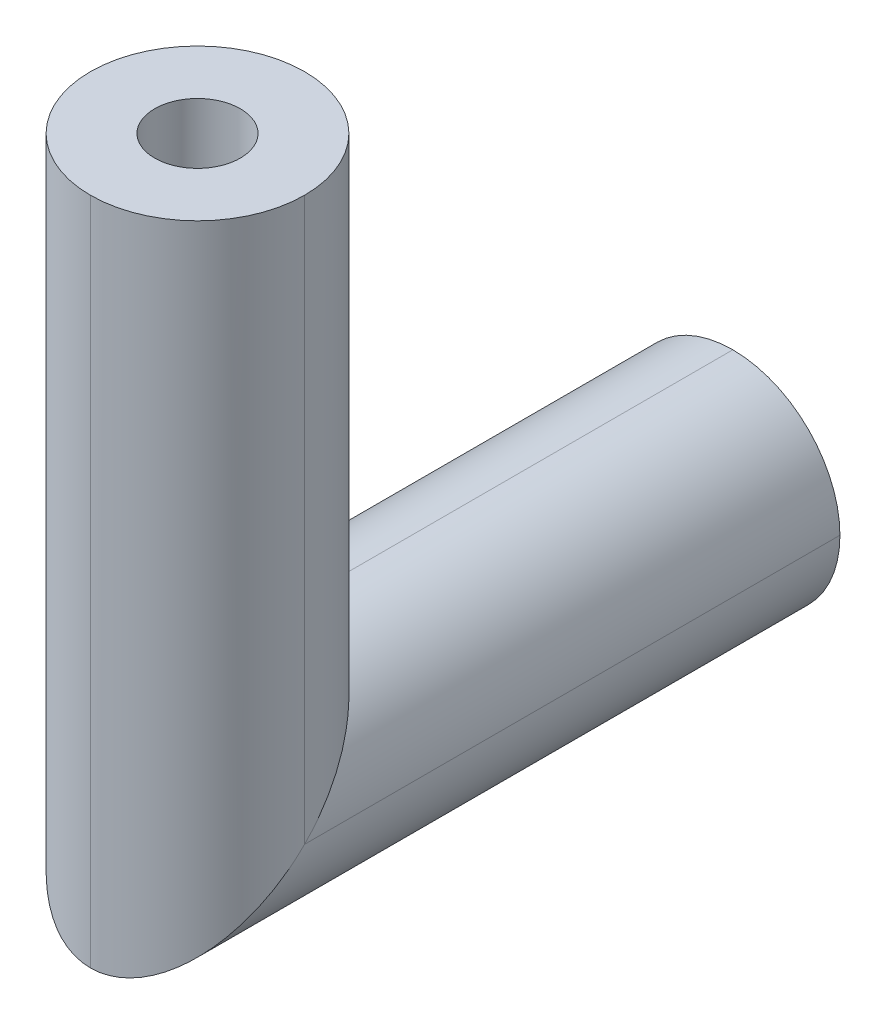
from build123d import *

# Parameters (mm, degrees)
ESQUISSE4_W             = 8
ESQUISSE4_H             = 4
BOSS_EXTRU_2_DEPTH      = 4
ESQUISSE10_R            = 0.8
ENL_V_MAT_EXTRU_3_DEPTH = 8
ENL_V_START             = -4
ESQUISSE11_R            = 0.8
ENL_V_MAT_EXTRU_4_DEPTH = 4
ESQUISSE7_R             = 0.8
ENL_V_MAT_EXTRU_2_DEPTH = 8
CONG_4_R                = 2


with BuildPart() as part:
    # Esquisse4 → Boss.-Extru.2 (new body)
    with BuildSketch(Plane(origin=(0, 0, 0), x_dir=(0, 0, -1), z_dir=(1, 0, 0))):
        with Locations((8, 2)):
            Rectangle(ESQUISSE4_W, ESQUISSE4_H)
        Polygon((4, 0), (4, 4), (4, 12.5), (0, 12.5), (0, 0), align=None)
    extrude(amount=BOSS_EXTRU_2_DEPTH)

    # Esquisse10 → Enlèv. mat.-Extru.3 (cut)
    with BuildSketch(Plane(origin=(0, 12.5, 0), x_dir=(1, 0, 0), z_dir=(0, 1, 0))):
        with Locations(Location((2, 2, 0), (0, 0, 270))):
            Circle(ESQUISSE10_R)
    extrude(amount=-ENL_V_MAT_EXTRU_3_DEPTH, mode=Mode.SUBTRACT)

    # Esquisse11 → Enlèv. mat.-Extru.4 (cut)
    with BuildSketch(Plane.XZ.offset(ENL_V_START)):
        with Locations(Location((2, -2, 0), (0, 0, 90))):
            Circle(ESQUISSE11_R)
    extrude(amount=ENL_V_MAT_EXTRU_4_DEPTH, mode=Mode.SUBTRACT)

    # Esquisse7 → Enlèv. mat.-Extru.2 (cut)
    with BuildSketch(Plane(origin=(0, 0, -12), x_dir=(1, 0, 0), z_dir=(0, 0, -1))):
        with Locations(Location((2, -2, 0), (0, 0, 270))):
            Circle(ESQUISSE7_R)
    extrude(amount=-ENL_V_MAT_EXTRU_2_DEPTH, mode=Mode.SUBTRACT)

    # Congé4
    # the kernel refuses this fillet: 2 mm, written as the material it takes off along each edge
    with BuildSketch(Plane(origin=(4, 0, -17), x_dir=(-1, 0, 0), z_dir=(0, 0, 1)), Plane(origin=(0, 0, 5), x_dir=(1, 0, 0), z_dir=(0, 0, -1))) as cong_4_piece_1:
        with BuildLine():
            CenterArc((CONG_4_R, -CONG_4_R), CONG_4_R, 90, 90)
            Line((0, -CONG_4_R), (0, 0))
            Line((0, 0), (CONG_4_R, 0))
        make_face()
    extrude(amount=22, mode=Mode.SUBTRACT)
    with BuildSketch(Plane(origin=(4, 17.5, -4), x_dir=(0, 0, 1), z_dir=(0, -1, 0)), Plane(origin=(0, 4, -4), x_dir=(0, 0, 1), z_dir=(0, 1, 0))) as cong_4_piece_2:
        with BuildLine():
            CenterArc((CONG_4_R, CONG_4_R), CONG_4_R, 180, 90)
            Line((0, CONG_4_R), (0, 0))
            Line((0, 0), (CONG_4_R, 0))
        make_face()
    extrude(amount=13.5, mode=Mode.SUBTRACT)
    with BuildSketch(Plane(origin=(4, 4, -17), x_dir=(0, -1, 0), z_dir=(0, 0, 1))) as cong_4_piece_3:
        with BuildLine():
            CenterArc((CONG_4_R, -CONG_4_R), CONG_4_R, 90, 90)
            Line((0, -CONG_4_R), (0, 0))
            Line((0, 0), (CONG_4_R, 0))
        make_face()
    extrude(amount=13, mode=Mode.SUBTRACT)
    with BuildSketch(Plane(origin=(0, 4, -17), x_dir=(0, -1, 0), z_dir=(0, 0, 1))) as cong_4_piece_4:
        with BuildLine():
            CenterArc((CONG_4_R, CONG_4_R), CONG_4_R, 180, 90)
            Line((0, CONG_4_R), (0, 0))
            Line((0, 0), (CONG_4_R, 0))
        make_face()
    extrude(amount=13, mode=Mode.SUBTRACT)
    with BuildSketch(Plane(origin=(4, 17.5, 0), x_dir=(0, 0, -1), z_dir=(0, -1, 0))) as cong_4_piece_5:
        with BuildLine():
            CenterArc((CONG_4_R, -CONG_4_R), CONG_4_R, 90, 90)
            Line((0, -CONG_4_R), (0, 0))
            Line((0, 0), (CONG_4_R, 0))
        make_face()
    extrude(amount=22.5, mode=Mode.SUBTRACT)
    with BuildSketch(Plane(origin=(0, 17.5, 0), x_dir=(0, 0, -1), z_dir=(0, -1, 0))) as cong_4_piece_6:
        with BuildLine():
            CenterArc((CONG_4_R, CONG_4_R), CONG_4_R, 180, 90)
            Line((0, CONG_4_R), (0, 0))
            Line((0, 0), (CONG_4_R, 0))
        make_face()
    extrude(amount=22.5, mode=Mode.SUBTRACT)
    with BuildSketch(Plane(origin=(4, 4, -12), x_dir=(0, -1, 0), z_dir=(0, 0, 1))) as cong_4_piece_7a_section:
        with BuildLine():
            CenterArc((CONG_4_R, -CONG_4_R), CONG_4_R, 90, 90)
            Line((0, -CONG_4_R), (0, 0))
            Line((0, 0), (CONG_4_R, 0))
        make_face()
    cong_4_piece_7a = extrude(amount=13, mode=Mode.PRIVATE)
    cong_4_piece_7a = split(cong_4_piece_7a, bisect_by=Plane(origin=(4, 4, 0), z_dir=(0, 0, -1)), keep=Keep.TOP, mode=Mode.PRIVATE)
    cong_4_piece_7a = cong_4_piece_7a - Plane(origin=(2, 4, -2), x_dir=(0, 0, 1), z_dir=(0, 1, 0)) * Cylinder(0.8, 35, mode=Mode.PRIVATE)
    cong_4_piece_7a = split(cong_4_piece_7a, bisect_by=Plane(origin=(4, 4, -4), z_dir=(0, 0, 1)), keep=Keep.TOP, mode=Mode.PRIVATE)
    with BuildSketch(Plane(origin=(4, 12.5, -4), x_dir=(0, 0, 1), z_dir=(0, -1, 0))) as cong_4_piece_7b_section:
        with BuildLine():
            CenterArc((CONG_4_R, CONG_4_R), CONG_4_R, 180, 90)
            Line((0, CONG_4_R), (0, 0))
            Line((0, 0), (CONG_4_R, 0))
        make_face()
    cong_4_piece_7b = extrude(amount=13.5, mode=Mode.PRIVATE)
    cong_4_piece_7b = split(cong_4_piece_7b, bisect_by=Plane(origin=(4, 0, -4), z_dir=(0, 1, 0)), keep=Keep.TOP, mode=Mode.PRIVATE)
    cong_4_piece_7b = split(cong_4_piece_7b, bisect_by=Plane(origin=(4, 4, -4), z_dir=(0, -1, 0)), keep=Keep.TOP, mode=Mode.PRIVATE)
    cong_4_piece_7b = cong_4_piece_7b - Plane(origin=(2, 2, -4), x_dir=(0, 1, 0), z_dir=(0, 0, -1)) * Cylinder(0.8, 35, mode=Mode.PRIVATE)
    cong_4_piece_7 = cong_4_piece_7a & cong_4_piece_7b
    add(cong_4_piece_7, mode=Mode.SUBTRACT)
    with BuildSketch(Plane(origin=(0, 4, -12), x_dir=(0, -1, 0), z_dir=(0, 0, 1))) as cong_4_piece_8a_section:
        with BuildLine():
            CenterArc((CONG_4_R, CONG_4_R), CONG_4_R, 180, 90)
            Line((0, CONG_4_R), (0, 0))
            Line((0, 0), (CONG_4_R, 0))
        make_face()
    cong_4_piece_8a = extrude(amount=13, mode=Mode.PRIVATE)
    cong_4_piece_8a = split(cong_4_piece_8a, bisect_by=Plane(origin=(0, 4, 0), z_dir=(0, 0, -1)), keep=Keep.TOP, mode=Mode.PRIVATE)
    cong_4_piece_8a = cong_4_piece_8a - Plane(origin=(2, 4, -2), x_dir=(0, 0, 1), z_dir=(0, 1, 0)) * Cylinder(0.8, 35, mode=Mode.PRIVATE)
    cong_4_piece_8a = split(cong_4_piece_8a, bisect_by=Plane(origin=(0, 4, -4), z_dir=(0, 0, 1)), keep=Keep.TOP, mode=Mode.PRIVATE)
    with BuildSketch(Plane(origin=(0, -1, -4), x_dir=(0, 0, 1), z_dir=(0, 1, 0))) as cong_4_piece_8b_section:
        with BuildLine():
            CenterArc((CONG_4_R, CONG_4_R), CONG_4_R, 180, 90)
            Line((0, CONG_4_R), (0, 0))
            Line((0, 0), (CONG_4_R, 0))
        make_face()
    cong_4_piece_8b = extrude(amount=13.5, mode=Mode.PRIVATE)
    cong_4_piece_8b = split(cong_4_piece_8b, bisect_by=Plane(origin=(0, 0, -4), z_dir=(0, 1, 0)), keep=Keep.TOP, mode=Mode.PRIVATE)
    cong_4_piece_8b = split(cong_4_piece_8b, bisect_by=Plane(origin=(0, 4, -4), z_dir=(0, -1, 0)), keep=Keep.TOP, mode=Mode.PRIVATE)
    cong_4_piece_8b = cong_4_piece_8b - Plane(origin=(2, 2, -4), x_dir=(0, 1, 0), z_dir=(0, 0, -1)) * Cylinder(0.8, 35, mode=Mode.PRIVATE)
    cong_4_piece_8 = cong_4_piece_8a & cong_4_piece_8b
    add(cong_4_piece_8, mode=Mode.SUBTRACT)


solid = part.part
